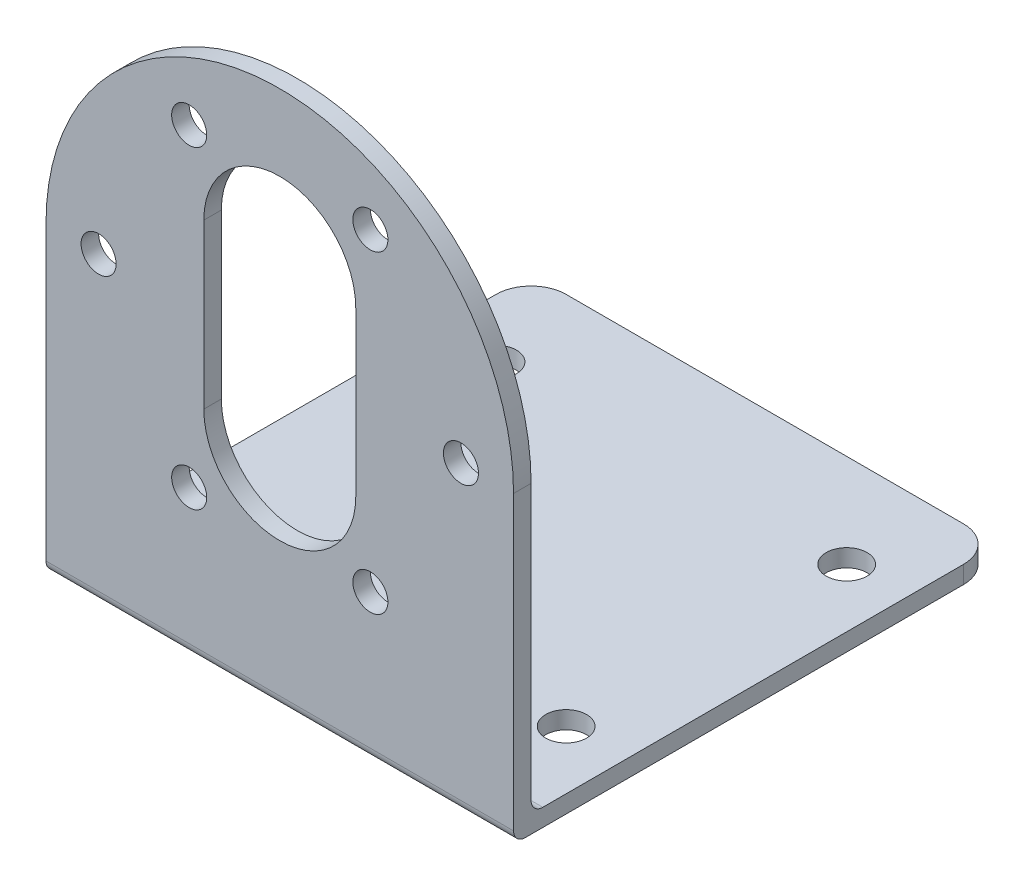
from build123d import *

# Parameters (mm, degrees)
SKETCH_1_R          = 1.5
EXTRUDE_1_DEPTH     = 1.5
SKETCH_2_W          = 40
SKETCH_2_H          = 1.5
EXTRUDE_2_DEPTH     = 40
SKETCH_3_R          = 1.75
CUT_EXTRUDE_1_DEPTH = 40
FILLET_1_R          = 3
FILLET_2_R          = 1


with BuildPart() as part:
    # 草图1 → 凸台-拉伸1 (new body)
    with BuildSketch(Plane.XY):
        with BuildLine():
            ThreePointArc((20, 0), (0, 20), (-20, 0))
            Line((-20, 0), (-20, -26))
            Line((-20, -26), (20, -26))
            Line((20, -26), (20, 0))
        make_face()
        with Locations((-7.75, -13.423393759)):
            Circle(SKETCH_1_R, mode=Mode.SUBTRACT)
        with Locations((7.75, -13.423393759)):
            Circle(SKETCH_1_R, mode=Mode.SUBTRACT)
        with Locations((-15.5, 0)):
            Circle(SKETCH_1_R, mode=Mode.SUBTRACT)
        with BuildLine():
            Line((-6.5, -7), (-6.5, 7))
            ThreePointArc((-6.5, 7), (0, 13.5), (6.5, 7))
            Line((6.5, 7), (6.5, -7))
            ThreePointArc((6.5, -7), (0, -13.5), (-6.5, -7))
        make_face(mode=Mode.SUBTRACT)
        with Locations((-7.75, 13.423393759)):
            Circle(SKETCH_1_R, mode=Mode.SUBTRACT)
        with Locations((15.5, 0)):
            Circle(SKETCH_1_R, mode=Mode.SUBTRACT)
        with Locations((7.75, 13.423393759)):
            Circle(SKETCH_1_R, mode=Mode.SUBTRACT)
    extrude(amount=EXTRUDE_1_DEPTH)

    # 草图2 → 凸台-拉伸2 (add)
    with BuildSketch(Plane(origin=(0, 0, 0), x_dir=(-1, 0, 0), z_dir=(0, 0, -1))):
        with Locations((0, -25.25)):
            Rectangle(SKETCH_2_W, SKETCH_2_H)
    extrude(amount=EXTRUDE_2_DEPTH)

    # 草图3 → 切除-拉伸1 (cut)
    with BuildSketch(Plane(origin=(0, -24.5, 0), x_dir=(1, 0, 0), z_dir=(0, 1, 0))):
        with Locations((-15, 32)):
            Circle(SKETCH_3_R)
        with Locations((-15, 8)):
            Circle(SKETCH_3_R)
        with Locations((15, 8)):
            Circle(SKETCH_3_R)
        with Locations((15, 32)):
            Circle(SKETCH_3_R)
    extrude(amount=-CUT_EXTRUDE_1_DEPTH, mode=Mode.SUBTRACT)

    # 圆角1
    fillet_1_edges = [part.edges().sort_by_distance(p)[0] for p in [
        (20, -25.25, -40),
        (-20, -25.25, -40),
    ]]
    fillet(fillet_1_edges, radius=FILLET_1_R)

    # 圆角2
    fillet_2_edges = [part.edges().sort_by_distance(p)[0] for p in [
        (0, -26, 1.5),
        (0, -24.5, 0),
    ]]
    fillet(fillet_2_edges, radius=FILLET_2_R)


solid = part.part
